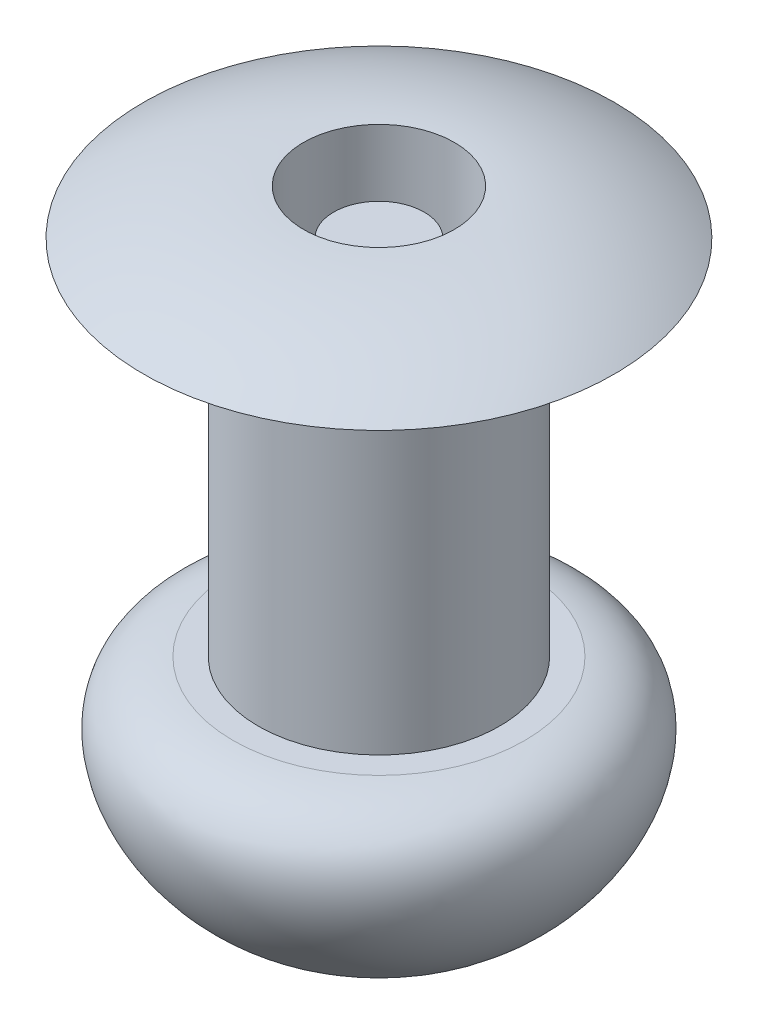
from build123d import *


with BuildPart() as part:
    # Szkic1 → Obrót1 (revolve)
    with BuildSketch(Plane(origin=(0, 0, 0), x_dir=(0, 0, -1), z_dir=(1, 0, 0))):
        with BuildLine():
            Line((0, 0), (0, -6))
            Line((0, -6), (0, -7.5))
            add(Edge.make_bspline(
                [(-0.956030427, -7.378190671), (-0.520263876, -7.5), (0, -7.5)],
                knots=[0.992852221, 0.992852221, 0.992852221, 1.570796327, 1.570796327, 1.570796327], degree=2, weights=[1, 0.958537313, 1]))
            add(Edge.make_bspline(
                [(-2.413891755, -6), (-3.858559437, -6.163296686), (-3.558358928, -8.322980362), (-0.971318098, -9.871940016), (-0.341145137, -7.79203191), (-0.956030427, -7.378190671)],
                knots=[0, 0, 0, 0, 0.454219308, 0.705200672, 1, 1, 1, 1], degree=3))
            Line((-2.413891755, -6), (-2, -6))
            Line((-2, -6), (-2, 0))
            Line((-2, 0), (-3.9, 0))
            ThreePointArc((-3.9, 0), (-2.627043935, 0.558888572), (-1.25, 0.75))
            Line((-1.25, 0.75), (-1.25, -6))
            Line((-1.25, -6), (-0.75, -6))
            Line((-0.75, -6), (-0.75, 0))
            Line((-0.75, 0), (0, 0))
        make_face()
    revolve(axis=Axis((0, 0, 0), (0, 1, 0)))


solid = part.part
